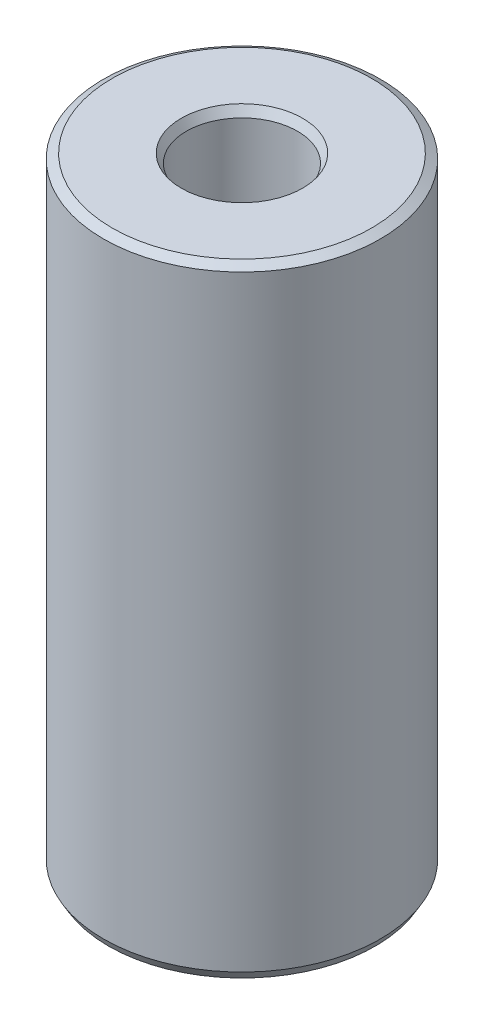
from build123d import *
from OCP.BRepFilletAPI import BRepFilletAPI_MakeChamfer

# Parameters (mm, degrees)
SKETCH1_R           = 10
BOSS_EXTRUDE1_DEPTH = 44.785737704
SKETCH2_R           = 4.016529155
CUT_EXTRUDE1_DEPTH  = 47.96554377
CHAMFER1_SIZE       = 0.364854668
CHAMFER1_SIZE2      = 0.631946823


with BuildPart() as part:
    # Sketch1 → Boss-Extrude1 (new body)
    with BuildSketch(Plane(origin=(0, 0, 0), x_dir=(1, 0, 0), z_dir=(0, 1, 0))):
        Circle(SKETCH1_R)
    extrude(amount=BOSS_EXTRUDE1_DEPTH)

    # Sketch2 → Cut-Extrude1 (cut, through all)
    with BuildSketch(Plane(origin=(0, 0, 0), x_dir=(1, 0, 0), z_dir=(0, 1, 0))):
        Circle(SKETCH2_R)
    extrude(amount=CUT_EXTRUDE1_DEPTH, mode=Mode.SUBTRACT)

    # Chamfer1: one chamfer whose edges measure the first distance from different faces: ONE call of the kernel's chamfer builder (chamfer() names one face for all edges)
    chamfer1_edges_1 = [part.edges().sort_by_distance(p)[0] for p in [
        (-4.016529155, 44.785737704, 0),
    ]]
    chamfer1_side_1 = [part.faces().sort_by_distance(p)[0] for p in [
        (-9.717157288, 44.785737704, 0),
    ]]
    chamfer1_edges_2 = [part.edges().sort_by_distance(p)[0] for p in [
        (-4.016529155, 0, 0),
    ]]
    chamfer1_side_2 = [part.faces().sort_by_distance(p)[0] for p in [
        (-4.016529155, 22.392868852, 0),
    ]]
    chamfer1_edges_3 = [part.edges().sort_by_distance(p)[0] for p in [
        (-10, 0, 0),
    ]]
    chamfer1_side_3 = [part.faces().sort_by_distance(p)[0] for p in [
        (-9.717157288, 0, 0),
    ]]
    chamfer1_edges_4 = [part.edges().sort_by_distance(p)[0] for p in [
        (-10, 44.785737704, 0),
    ]]
    chamfer1_side_4 = [part.faces().sort_by_distance(p)[0] for p in [
        (-10, 22.392868852, 0),
    ]]
    chamfer1 = BRepFilletAPI_MakeChamfer(part.part.solid().wrapped)
    for e in chamfer1_edges_1:
        chamfer1.Add(CHAMFER1_SIZE, CHAMFER1_SIZE2, e.wrapped, chamfer1_side_1[0].wrapped)  # the first distance lies on this face
    for e in chamfer1_edges_2:
        chamfer1.Add(CHAMFER1_SIZE, CHAMFER1_SIZE2, e.wrapped, chamfer1_side_2[0].wrapped)  # the first distance lies on this face
    for e in chamfer1_edges_3:
        chamfer1.Add(CHAMFER1_SIZE, CHAMFER1_SIZE2, e.wrapped, chamfer1_side_3[0].wrapped)  # the first distance lies on this face
    for e in chamfer1_edges_4:
        chamfer1.Add(CHAMFER1_SIZE, CHAMFER1_SIZE2, e.wrapped, chamfer1_side_4[0].wrapped)  # the first distance lies on this face
    add(Compound.cast(chamfer1.Shape()), mode=Mode.REPLACE)


solid = part.part
